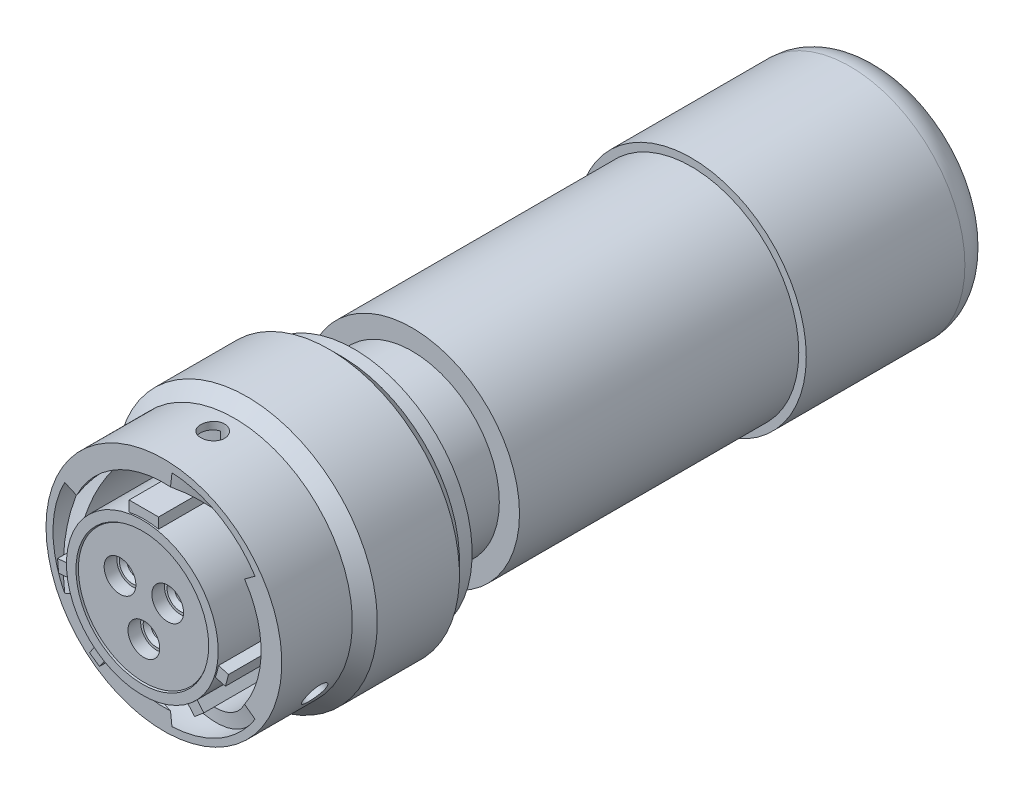
from build123d import *

# Parameters (mm, degrees)
SKETCH3_W               = 30.5696
SKETCH3_H               = 6.5532
BOSS_EXTRUDE1_START     = -9.2202
BOSS_EXTRUDE1_DEPTH     = 9.0678
SKETCH6_R               = 1.1938
CUT_EXTRUDE1_DEPTH      = 38.374523408
CUT_SWEEP1_PITCH        = 19.5072
CIRPATTERN1_COUNT       = 3
SKETCH12_3S_R           = 1.5875
CUT_EXTRUDE12_3S_DEPTH  = 9.0678
EXTRUDE_THIN12_3S_START = -1.27
SKETCH12_3S_2_R         = 1.5875
SKETCH12_3S_2_R_2       = 0.9525
EXTRUDE_THIN12_3S_DEPTH = 32.4746
CHAMFER12_3S_SIZE       = 0.381


with BuildPart() as part:
    # Sketch3 → Revolve1 (revolve)
    with BuildSketch(Plane(origin=(0, 0, 0), x_dir=(0, 0, -1), z_dir=(1, 0, 0)), mode=Mode.PRIVATE) as revolve1_sk:
        Polygon((9.7282, 8.636), (9.7282, 7.672916667), (19.8, 7.672916667), (20.858333333, 8.73125), (31.441666667, 8.73125), (32.5, 7.672916667), (32.5, 6.6421), (0, 6.6421), (0, 7.5946), (9.2202, 7.5946), (9.2202, 8.636), align=None)
        with Locations((15.4372, 3.2766)):
            Rectangle(SKETCH3_W, SKETCH3_H)
    revolve(revolve1_sk.sketch.rotate(Axis((0, 0, 0), (0, 0, -1)), 90), axis=Axis((0, 0, 0), (0, 0, -1)))

    # Sketch4 → Boss-Extrude1 (add)
    with BuildSketch(Plane.XY.offset(BOSS_EXTRUDE1_START)):
        with BuildLine():
            Line((-1.4732, 8.509417005), (1.4732, 8.509417005))
            Line((1.4732, 8.509417005), (1.4732, 7.450344349))
            ThreePointArc((1.4732, 7.450344349), (0, 7.5946), (-1.4732, 7.450344349))
            Line((-1.4732, 7.450344349), (-1.4732, 8.509417005))
        make_face()
        with BuildLine():
            Line((8.478703395, -1.640757368), (8.163151215, -2.818414135))
            Line((8.163151215, -2.818414135), (7.154374095, -2.548113121))
            ThreePointArc((7.154374095, -2.548113121), (7.33582028, -1.96562712), (7.469926274, -1.370456353))
            Line((7.469926274, -1.370456353), (8.478703395, -1.640757368))
        make_face()
        with BuildLine():
            Line((6.004247455, -6.20721423), (5.07028607, -6.990900884))
            Line((5.07028607, -6.990900884), (4.398982522, -6.190872469))
            ThreePointArc((4.398982522, -6.190872469), (4.881714781, -5.817801128), (5.332943907, -5.407185816))
            Line((5.332943907, -5.407185816), (6.004247455, -6.20721423))
        make_face()
        with BuildLine():
            Line((-4.441694942, -7.406202944), (-5.440405114, -6.706898553))
            Line((-5.440405114, -6.706898553), (-4.84138315, -5.851406528))
            ThreePointArc((-4.84138315, -5.851406528), (-4.356083604, -6.221132116), (-3.842672977, -6.550710919))
            Line((-3.842672977, -6.550710919), (-4.441694942, -7.406202944))
        make_face()
        with BuildLine():
            Line((-8.528547084, -1.358079759), (-8.634807366, -0.143519183))
            Line((-8.634807366, -0.143519183), (-7.594418558, -0.052496957))
            ThreePointArc((-7.594418558, -0.052496957), (-7.565700254, -0.661913004), (-7.488158276, -1.267057533))
            Line((-7.488158276, -1.267057533), (-8.528547084, -1.358079759))
        make_face()
    extrude(amount=BOSS_EXTRUDE1_DEPTH)

    # Sketch12-3S → Cut-Extrude12-3S (cut)
    with BuildSketch(Plane.XY.offset(-0.1524)):
        with Locations((2.3876, 1.4732)):
            Circle(SKETCH12_3S_R)
        with Locations((0, -2.8194)):
            Circle(SKETCH12_3S_R)
        with Locations((-2.3876, 1.4732)):
            Circle(SKETCH12_3S_R)
    extrude(amount=-CUT_EXTRUDE12_3S_DEPTH, mode=Mode.SUBTRACT)

    # Sketch12-3S<2> → Extrude-Thin12-3S (add)
    # profile 1 of 3: a face of its own
    with BuildSketch(Plane.XY.offset(-0.1524).offset(EXTRUDE_THIN12_3S_START)):
        with Locations((2.3876, 1.4732)):
            Circle(SKETCH12_3S_2_R)
        with Locations((2.3876, 1.4732)):
            Circle(SKETCH12_3S_2_R_2, mode=Mode.SUBTRACT)
    # profile 2 of 3: a face of its own
    with BuildSketch(Plane.XY.offset(-0.1524).offset(EXTRUDE_THIN12_3S_START)):
        with Locations((0, -2.8194)):
            Circle(SKETCH12_3S_2_R)
        with Locations((0, -2.8194)):
            Circle(SKETCH12_3S_2_R_2, mode=Mode.SUBTRACT)
    # profile 3 of 3: a face of its own
    with BuildSketch(Plane.XY.offset(-0.1524).offset(EXTRUDE_THIN12_3S_START)):
        with Locations((-2.3876, 1.4732)):
            Circle(SKETCH12_3S_2_R)
        with Locations((-2.3876, 1.4732)):
            Circle(SKETCH12_3S_2_R_2, mode=Mode.SUBTRACT)
    extrude(amount=-EXTRUDE_THIN12_3S_DEPTH)

    # Chamfer12-3S
    chamfer12_3s_edges = [part.edges().sort_by_distance(p)[0] for p in [
        (1.4351, 1.4732, -1.4224),
        (-0.9525, -2.8194, -1.4224),
        (-3.3401, 1.4732, -1.4224),
    ]]
    chamfer(chamfer12_3s_edges, length=CHAMFER12_3S_SIZE)


with BuildPart() as body_2:
    # Sketch5 → Revolve2 (revolve)
    with BuildSketch(Plane(origin=(0, 0, 0), x_dir=(0, 0, -1), z_dir=(1, 0, 0)), mode=Mode.PRIVATE) as revolve2_sk:
        Polygon((2.159, 11.8), (2.159, 9.7282), (17.399, 9.7282), (17.399, 10.9982), (21.209, 10.9982), (21.209, 11.8), (19.939, 11.8), (18.689, 13.05), (10.4702, 13.05), (9.2202, 11.8), align=None)
    revolve(revolve2_sk.sketch.rotate(Axis((0, 0, -32.5), (0, 0, 1)), 90), axis=Axis((0, 0, -32.5), (0, 0, 1)))

    # Sketch6 → Cut-Extrude1 (cut, through all)
    with BuildSketch(Plane(origin=(0, 0, 0), x_dir=(1, 0, 0), z_dir=(0, 1, 0))):
        with Locations(Location((0, 7.0358, 0), (0, 0, 90))):
            Circle(SKETCH6_R)
    cut_extrude1 = extrude(amount=CUT_EXTRUDE1_DEPTH, mode=Mode.SUBTRACT)

    # Cut-Sweep1: arcs per turn and ends read off the stored shape
    # Cut-Sweep1: the profile of Sketch8 screwed along a right-hand helix through 1.25 turns, 20 arcs to a turn; built about Z, then put on its axis
    cut_sweep1_z = Axis((0, 0, 0), (0, 0, 1))
    cut_sweep1_corners = [(9.634605379, 0.409289625, -20.789672785), (11.021935612, 0.409289625, -20.789672785), (11.021935612, -0.409289625, -18.224727215), (9.634605379, -0.409289625, -18.224727215)]
    with BuildLine(mode=Mode.PRIVATE) as cut_sweep1_profile:
        Line(cut_sweep1_corners[0], cut_sweep1_corners[1])
        Line(cut_sweep1_corners[2], cut_sweep1_corners[3])
        ThreePointArc((11.021935612, 0.409289625, -20.789672785), (11.103842536, 0, -19.5072), (11.021935612, -0.409289625, -18.224727215))
        ThreePointArc((9.634605379, -0.409289625, -18.224727215), (9.7282, 0, -19.5072), (9.634605379, 0.409289625, -20.789672785))
    cut_sweep1_cap = Face(cut_sweep1_profile.wire())
    cut_sweep1_arcs = [((11.021935612, 0.409289625, -20.789672785), (11.186358133, 0, -19.5072), (11.021935612, -0.409289625, -18.224727215), (1, 0.9926235513315216, 1)), ((9.634605379, -0.409289625, -18.224727215), (9.822703839, 0, -19.5072), (9.634605379, 0.409289625, -20.789672785), (1, 0.9903790401646793, 1))]  # start, shoulder, end, weights
    cut_sweep1_turn_angles = [0, 9, 18, 27, 36, 45, 54, 63, 72, 81, 90, 99, 108, 117, 126, 135, 144, 153, 162, 171, 180, 189, 198, 207, 216, 225, 234, 243, 252, 261, 270, 279, 288, 297, 306, 315, 324, 333, 342, 351, 360]
    cut_sweep1_turn_weights = [1, 0.9876883405951378, 1, 0.9876883405951378, 1, 0.9876883405951378, 1, 0.9876883405951378, 1, 0.9876883405951378, 1, 0.9876883405951378, 1, 0.9876883405951378, 1, 0.9876883405951378, 1, 0.9876883405951378, 1, 0.9876883405951378, 1, 0.9876883405951378, 1, 0.9876883405951378, 1, 0.9876883405951378, 1, 0.9876883405951378, 1, 0.9876883405951378, 1, 0.9876883405951378, 1, 0.9876883405951378, 1, 0.9876883405951378, 1, 0.9876883405951378, 1, 0.9876883405951378, 1]
    cut_sweep1_turn_rails = [Edge.make_bspline([Vector(p[0], p[1], 0).rotate(cut_sweep1_z, cut_sweep1_turn_angles[k]) / cut_sweep1_turn_weights[k] + Vector(0, 0, p[2] + CUT_SWEEP1_PITCH * cut_sweep1_turn_angles[k] / 360) for k in range(41)], [0, 0, 0, 1, 1, 2, 2, 3, 3, 4, 4, 5, 5, 6, 6, 7, 7, 8, 8, 9, 9, 10, 10, 11, 11, 12, 12, 13, 13, 14, 14, 15, 15, 16, 16, 17, 17, 18, 18, 19, 19, 20, 20, 20], 2, cut_sweep1_turn_weights) for p in cut_sweep1_corners]
    cut_sweep1_turn_sides = [*[Face.make_surface_from_curves(cut_sweep1_turn_rails[p[0]], cut_sweep1_turn_rails[p[1]]) for p in [(0, 1), (2, 3)]], *[Face.make_bezier_surface([[Vector(p[j][0], p[j][1], 0).rotate(cut_sweep1_z, cut_sweep1_turn_angles[2 * i + k]) / cut_sweep1_turn_weights[2 * i + k] + Vector(0, 0, p[j][2] + CUT_SWEEP1_PITCH * cut_sweep1_turn_angles[2 * i + k] / 360) for k in range(3)] for j in range(3)], [[p[3][j] * cut_sweep1_turn_weights[2 * i + k] for k in range(3)] for j in range(3)]) for p in cut_sweep1_arcs for i in range(20)]]
    cut_sweep1_last_angles = [360, 369, 378, 387, 396, 405, 414, 423, 432, 441, 450]
    cut_sweep1_last_weights = [1, 0.9876883405951378, 1, 0.9876883405951378, 1, 0.9876883405951378, 1, 0.9876883405951378, 1, 0.9876883405951378, 1]
    cut_sweep1_last_rails = [Edge.make_bspline([Vector(p[0], p[1], 0).rotate(cut_sweep1_z, cut_sweep1_last_angles[k]) / cut_sweep1_last_weights[k] + Vector(0, 0, p[2] + CUT_SWEEP1_PITCH * cut_sweep1_last_angles[k] / 360) for k in range(11)], [0, 0, 0, 1, 1, 2, 2, 3, 3, 4, 4, 5, 5, 5], 2, cut_sweep1_last_weights) for p in cut_sweep1_corners]
    cut_sweep1_last_sides = [*[Face.make_surface_from_curves(cut_sweep1_last_rails[p[0]], cut_sweep1_last_rails[p[1]]) for p in [(0, 1), (2, 3)]], *[Face.make_bezier_surface([[Vector(p[j][0], p[j][1], 0).rotate(cut_sweep1_z, cut_sweep1_last_angles[2 * i + k]) / cut_sweep1_last_weights[2 * i + k] + Vector(0, 0, p[j][2] + CUT_SWEEP1_PITCH * cut_sweep1_last_angles[2 * i + k] / 360) for k in range(3)] for j in range(3)], [[p[3][j] * cut_sweep1_last_weights[2 * i + k] for k in range(3)] for j in range(3)]) for p in cut_sweep1_arcs for i in range(5)]]
    cut_sweep1 = Plane(origin=(0, 0, -2.159), x_dir=(-1, 0, 0), z_dir=(0, 0, -1)) * Solid(Shell([*cut_sweep1_turn_sides, *cut_sweep1_last_sides, cut_sweep1_cap, cut_sweep1_cap.rotate(cut_sweep1_z, 450).moved(Location((0, 0, CUT_SWEEP1_PITCH * 450 / 360)))]))
    add(cut_sweep1, mode=Mode.SUBTRACT)

    # CirPattern1: Cut-Extrude1, Cut-Sweep1 ×3 about axis
    cirpattern1_axis = Axis((0, 0, -32.5), (0, 0, -1))
    add([cut_extrude1.rotate(cirpattern1_axis, i * 360 / CIRPATTERN1_COUNT) for i in range(1, CIRPATTERN1_COUNT)], mode=Mode.SUBTRACT)
    add([cut_sweep1.rotate(cirpattern1_axis, i * 360 / CIRPATTERN1_COUNT) for i in range(1, CIRPATTERN1_COUNT)], mode=Mode.SUBTRACT)


with BuildPart() as body_3:
    # Sketch9 → Revolve3 (revolve)
    with BuildSketch(Plane(origin=(0, 0, 0), x_dir=(0, 0, -1), z_dir=(1, 0, 0)), mode=Mode.PRIVATE) as revolve3_sk:
        with BuildLine():
            Line((27, 10.75), (27, 8.73125))
            Line((27, 8.73125), (70.825, 8.73125))
            ThreePointArc((70.825, 8.73125), (71.11226213, 8.61226213), (71.23125, 8.325))
            Line((71.23125, 8.325), (71.23125, 5.15))
            Line((71.23125, 5.15), (74, 5.15))
            Line((74, 5.15), (74, 8.325))
            ThreePointArc((74, 8.325), (73.07006403, 10.57006403), (70.825, 11.5))
            Line((70.825, 11.5), (54.95, 11.5))
            Line((54.95, 11.5), (54.95, 10.75))
            Line((54.95, 10.75), (27, 10.75))
        make_face()
    revolve(revolve3_sk.sketch.rotate(Axis((0, 0, 0), (0, 0, -1)), 90), axis=Axis((0, 0, 0), (0, 0, -1)))


solid = Compound([part.part, body_2.part, body_3.part])
